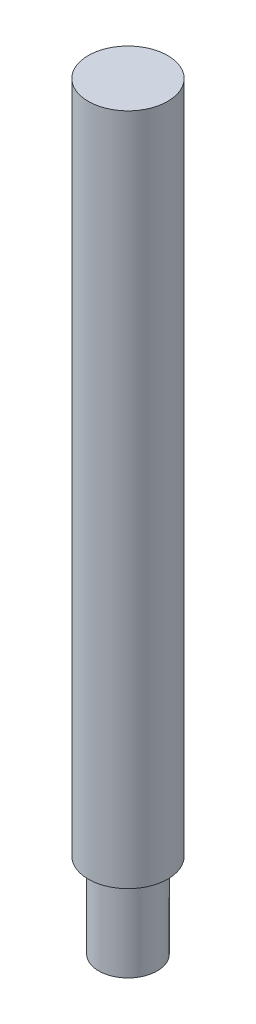
from build123d import *

# Parameters (mm, degrees)
SKETCH1_R           = 2.38125
BOSS_EXTRUDE1_DEPTH = 40.3733
SKETCH2_R           = 1.7526
BOSS_EXTRUDE2_DEPTH = 5.08


with BuildPart() as part:
    # Sketch1 → Boss-Extrude1 (new body)
    with BuildSketch(Plane(origin=(0, 0, 0), x_dir=(1, 0, 0), z_dir=(0, 1, 0))):
        Circle(SKETCH1_R)
    extrude(amount=BOSS_EXTRUDE1_DEPTH)

    # Sketch2 → Boss-Extrude2 (add)
    with BuildSketch(Plane.XZ):
        Circle(SKETCH2_R)
    extrude(amount=BOSS_EXTRUDE2_DEPTH)


solid = part.part
